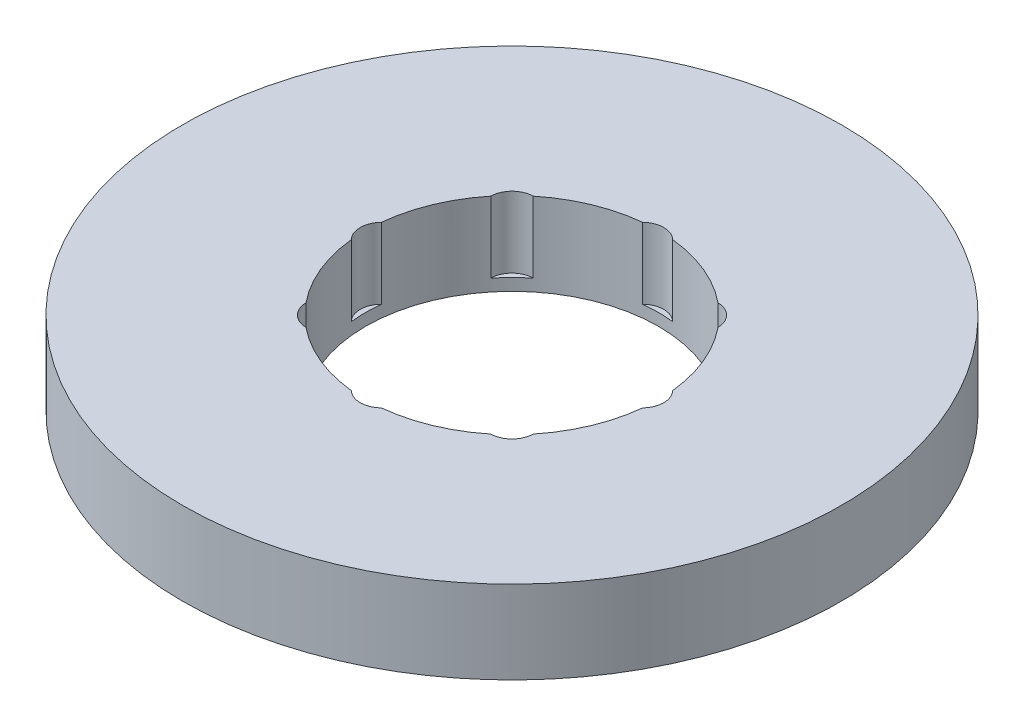
from build123d import *

# Parameters (mm, degrees)
SKETCH1_R           = 67.5
BOSS_EXTRUDE1_DEPTH = 17
SKETCH2_R           = 30
CUT_EXTRUDE1_DEPTH  = 97.961332499
SKETCH3_R           = 4.426884734
CUT_EXTRUDE2_DEPTH  = 14.536211372
CIRPATTERN1_COUNT   = 8


with BuildPart() as part:
    # Sketch1 → Boss-Extrude1 (new body)
    with BuildSketch(Plane(origin=(0, 0, 0), x_dir=(1, 0, 0), z_dir=(0, 1, 0))):
        Circle(SKETCH1_R)
    extrude(amount=BOSS_EXTRUDE1_DEPTH)

    # Sketch2 → Cut-Extrude1 (cut, through all)
    with BuildSketch(Plane(origin=(0, 0, 0), x_dir=(1, 0, 0), z_dir=(0, 1, 0))):
        Circle(SKETCH2_R)
    extrude(amount=CUT_EXTRUDE1_DEPTH, mode=Mode.SUBTRACT)

    # Sketch3 → Cut-Extrude2 (cut)
    with BuildSketch(Plane(origin=(0, 17, 0), x_dir=(1, 0, 0), z_dir=(0, 1, 0))):
        with Locations((-26.658813069, 0)):
            Circle(SKETCH3_R)
    cut_extrude2 = extrude(amount=-CUT_EXTRUDE2_DEPTH, mode=Mode.SUBTRACT)

    # CirPattern1: Cut-Extrude2 ×8 about axis
    cirpattern1_axis = Axis((0, 0, 0), (0, 1, 0))
    for i in range(1, CIRPATTERN1_COUNT):
        add(cut_extrude2.rotate(cirpattern1_axis, i * 360 / CIRPATTERN1_COUNT), mode=Mode.SUBTRACT)


solid = part.part
